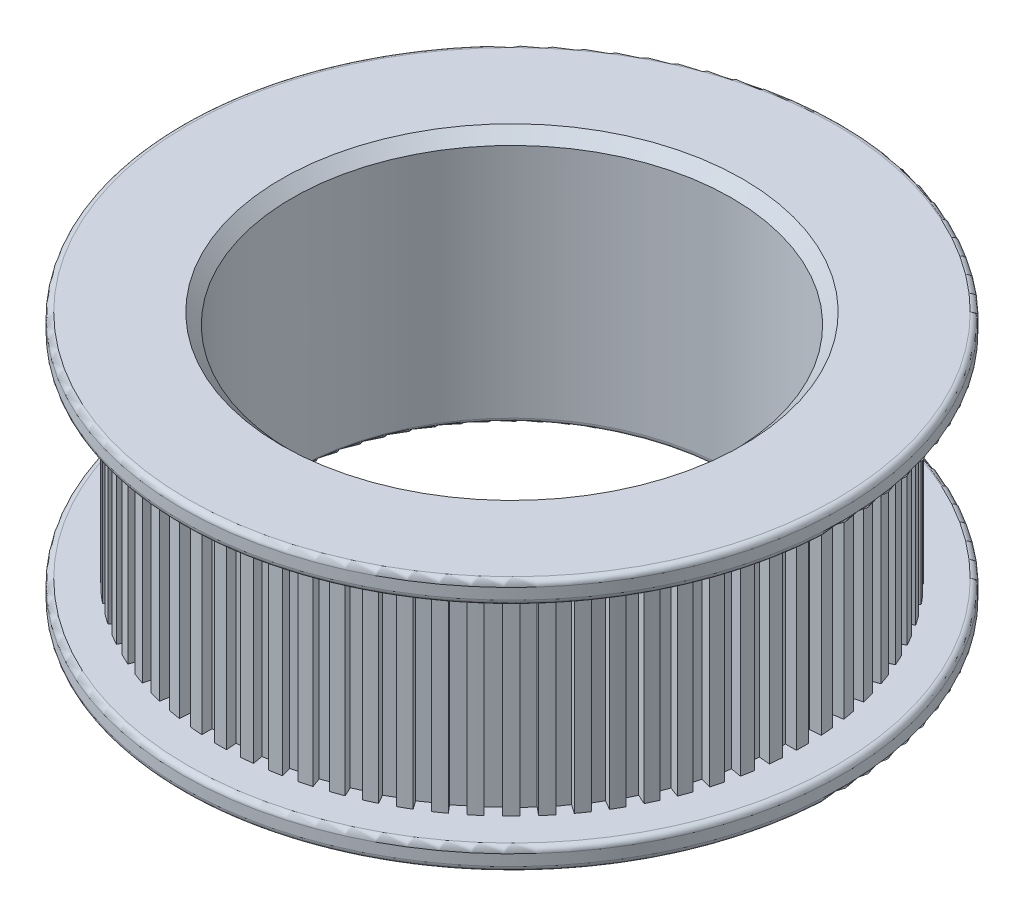
from build123d import *

# Parameters (mm, degrees)
CHAMFER1_SIZE      = 25.4
FILLET1_R          = 12.7
SKETCH3_W          = 30.48
SKETCH3_H          = 30.48
CUT_EXTRUDE1_DEPTH = 482.6
CIRPATTERN1_COUNT  = 72
FILLET2_R          = 12.7


with BuildPart() as part:
    # Sketch1 → Revolve1 (revolve)
    with BuildSketch(Plane.XY, mode=Mode.PRIVATE) as revolve1_sk:
        Polygon((508, 0), (762, 0), (762, 50.8), (673.1, 50.8), (673.1, 533.4), (762, 533.4), (762, 584.2), (508, 584.2), align=None)
    revolve(revolve1_sk.sketch.rotate(Axis((0, 0, 0), (0, 1, 0)), 90), axis=Axis((0, 0, 0), (0, 1, 0)))

    # Chamfer1
    chamfer1_edges = [part.edges().sort_by_distance(p)[0] for p in [
        (0, 584.2, 508),
    ]]
    chamfer(chamfer1_edges, length=CHAMFER1_SIZE)

    # Fillet1
    fillet1_edges = [part.edges().sort_by_distance(p)[0] for p in [
        (0, 584.2, 762),
        (0, 533.4, 762),
        (0, 50.8, 762),
        (0, 0, 762),
    ]]
    fillet(fillet1_edges, radius=FILLET1_R)

    # Sketch3 → Cut-Extrude1 (cut)
    with BuildSketch(Plane(origin=(0, 50.8, 0), x_dir=(1, 0, 0), z_dir=(0, 1, 0))):
        with Locations((30.48, 662.94)):
            Rectangle(SKETCH3_W, SKETCH3_H)
    cut_extrude1 = extrude(amount=CUT_EXTRUDE1_DEPTH, mode=Mode.SUBTRACT)

    # CirPattern1: Cut-Extrude1 ×72 about axis
    cirpattern1_axis = Axis((0, 0, 0), (0, 1, 0))
    for i in range(1, CIRPATTERN1_COUNT):
        add(cut_extrude1.rotate(cirpattern1_axis, i * 360 / CIRPATTERN1_COUNT), mode=Mode.SUBTRACT)

    # Fillet2
    fillet2_edges = [part.edges().sort_by_distance(p)[0] for p in [
        (0, 0, 508),
    ]]
    fillet(fillet2_edges, radius=FILLET2_R)


solid = part.part
